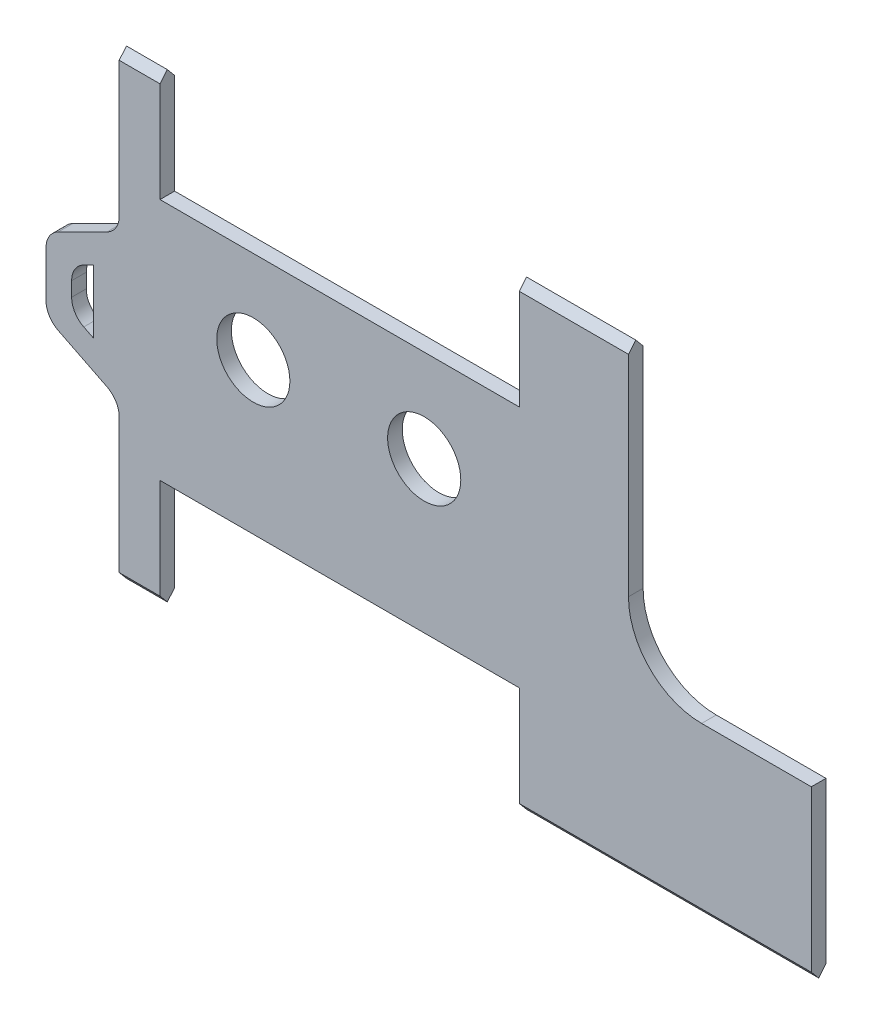
from build123d import *

# Parameters (mm, degrees)
SKETCH1_R           = 5
BOSS_EXTRUDE1_DEPTH = 1
CUT_EXTRUDE1_DEPTH  = 161.061343452
FILLET1_R           = 10
FILLET2_R           = 3


with BuildPart() as part:
    # Sketch1 → Boss-Extrude1 (new, symmetric)
    with BuildSketch(Plane.XY.offset(11.1483132)):
        Polygon((12.423, 91.8975), (22.423, 86.8975), (22.423, 65.272), (28.004997253, 65.272), (28.004997253, 80.272), (77.123000954, 80.272), (77.123000954, 65.272), (117.048, 65.272), (117.048, 88.523), (92.048, 88.523), (92.048, 128.523), (77.123000954, 128.523), (77.123000954, 113.523), (28.004997253, 113.523), (28.004997253, 128.523), (22.423, 128.523), (22.423, 106.8975), (12.423, 101.8975), align=None)
        Polygon((18.923, 92.560618961), (15.923, 94.060618961), (15.923, 99.734381039), (18.923, 101.234381039), align=None, mode=Mode.SUBTRACT)
        with Locations((64.123001099, 100.880996704)):
            Circle(SKETCH1_R, mode=Mode.SUBTRACT)
        with Locations((40.758998871, 100.90599823)):
            Circle(SKETCH1_R, mode=Mode.SUBTRACT)
    extrude(amount=BOSS_EXTRUDE1_DEPTH, both=True)

    # Sketch2 → Cut-Extrude1 (cut, through all)
    with BuildSketch(Plane.ZY.offset(-22.423)):
        Polygon((10.101339955, 128.523), (10.101339955, 127.168225732), (11.1483132, 128.412378938), (12.195286445, 127.168225732), (12.195286445, 128.523), align=None)
        Polygon((12.195286445, 66.626774268), (12.195286445, 65.272), (10.101339955, 65.272), (10.101339955, 66.626774268), (11.1483132, 65.382621062), align=None)
    extrude(amount=-CUT_EXTRUDE1_DEPTH, mode=Mode.SUBTRACT)

    # Fillet1
    fillet1_edges = [part.edges().sort_by_distance(p)[0] for p in [
        (92.048, 88.523, 11.1483132),
    ]]
    fillet(fillet1_edges, radius=FILLET1_R)

    # Fillet2
    fillet2_edges = [part.edges().sort_by_distance(p)[0] for p in [
        (15.923, 99.734381039, 11.1483132),
        (15.923, 94.060618961, 11.1483132),
        (22.423, 106.8975, 11.1483132),
        (12.423, 101.8975, 11.1483132),
        (12.423, 91.8975, 11.1483132),
        (22.423, 86.8975, 11.1483132),
    ]]
    fillet(fillet2_edges, radius=FILLET2_R)


solid = part.part
